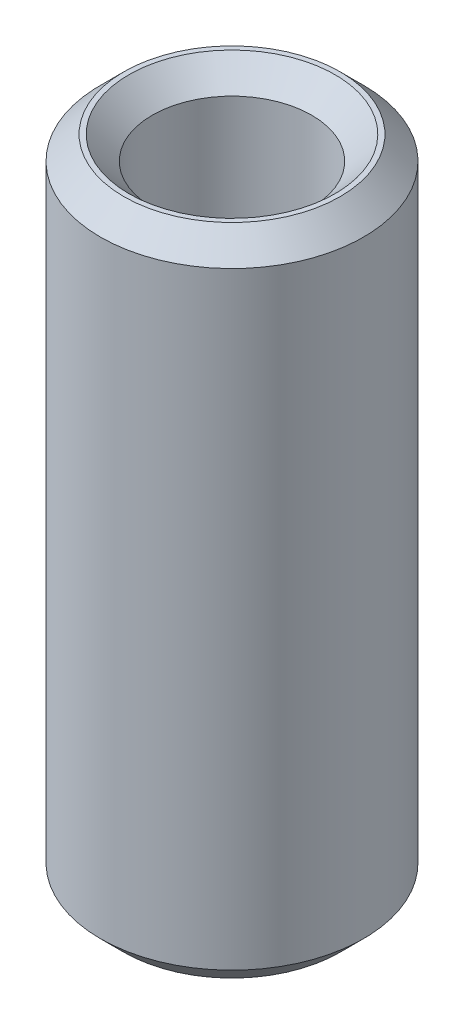
from build123d import *

# Parameters (mm, degrees)
SKETCH1_R           = 10
BOSS_EXTRUDE1_DEPTH = 49.749148898
SKETCH2_R           = 6.061903632
CUT_EXTRUDE1_DEPTH  = 52.720187704
CHAMFER1_SIZE       = 1.77669527


with BuildPart() as part:
    # Sketch1 → Boss-Extrude1 (new body)
    with BuildSketch(Plane(origin=(0, 0, 0), x_dir=(1, 0, 0), z_dir=(0, 1, 0))):
        Circle(SKETCH1_R)
    extrude(amount=BOSS_EXTRUDE1_DEPTH)

    # Sketch2 → Cut-Extrude1 (cut, through all)
    with BuildSketch(Plane(origin=(0, 0, 0), x_dir=(1, 0, 0), z_dir=(0, 1, 0))):
        Circle(SKETCH2_R)
    extrude(amount=CUT_EXTRUDE1_DEPTH, mode=Mode.SUBTRACT)

    # Chamfer1
    chamfer1_edges = [part.edges().sort_by_distance(p)[0] for p in [
        (-6.061903632, 49.749148898, 0),
        (-6.061903632, 0, 0),
        (-10, 0, 0),
        (-10, 49.749148898, 0),
    ]]
    chamfer(chamfer1_edges, length=CHAMFER1_SIZE)


solid = part.part
